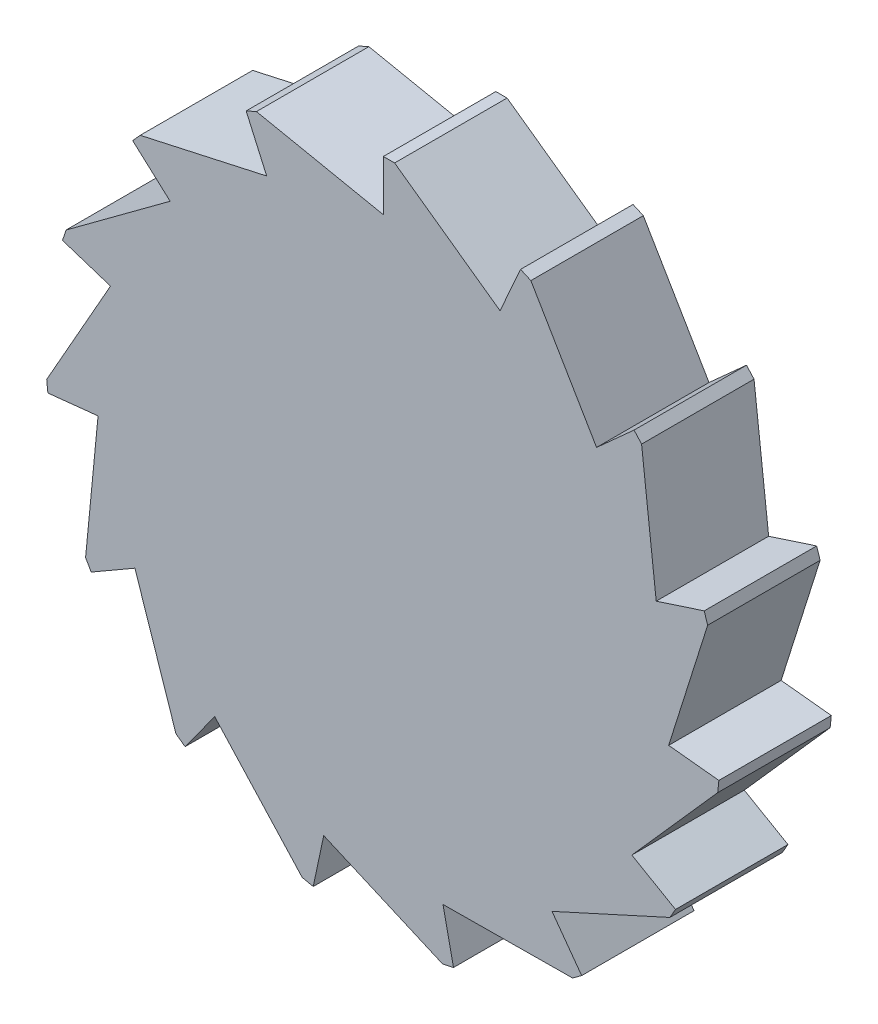
from build123d import *

# Parameters (mm, degrees)
BOSS_EXTRUDE1_DEPTH = 10


with BuildPart() as part:
    # Sketch1 → Boss-Extrude1 (new body)
    with BuildSketch(Plane.XY):
        Polygon((0, 25.51264103), (0, 30), (1.000891574, 30), (10.376925968, 23.306957325), (12.202099292, 27.406363729), (13.116459243, 26.99926445), (18.959587166, 17.071288962), (22.294344764, 20.073918191), (22.96407195, 19.330110797), (24.263963499, 7.88383965), (28.531695489, 9.270509831), (28.840987995, 8.318605378), (25.372880113, -2.666797161), (29.835656861, -3.135853898), (29.731035203, -4.131262483), (22.094595249, -12.756320515), (25.980762114, -15), (25.480316326, -15.86679753), (14.995954144, -20.640160164), (17.633557569, -24.270509831), (16.823819276, -24.858819138), (5.304376334, -24.955128612), (6.237350725, -29.344428022), (5.258331033, -29.552525082), (-5.304376334, -24.955128612), (-6.237350725, -29.344428022), (-7.216370416, -29.136330963), (-14.995954144, -20.640160164), (-17.633557569, -24.270509831), (-18.443295862, -23.682200525), (-22.094595249, -12.756320515), (-25.980762114, -15), (-26.481207901, -14.13320247), (-25.372880113, -2.666797161), (-29.835656861, -3.135853898), (-29.940278519, -2.140445313), (-24.263963499, 7.88383965), (-28.531695489, 9.270509831), (-28.222402983, 10.222414285), (-18.959587165, 17.071288962), (-22.294344764, 20.073918191), (-21.624617578, 20.817725585), (-10.376925968, 23.306957325), (-12.202099292, 27.406363729), (-11.287739341, 27.813463008), align=None)
    extrude(amount=BOSS_EXTRUDE1_DEPTH)


solid = part.part
